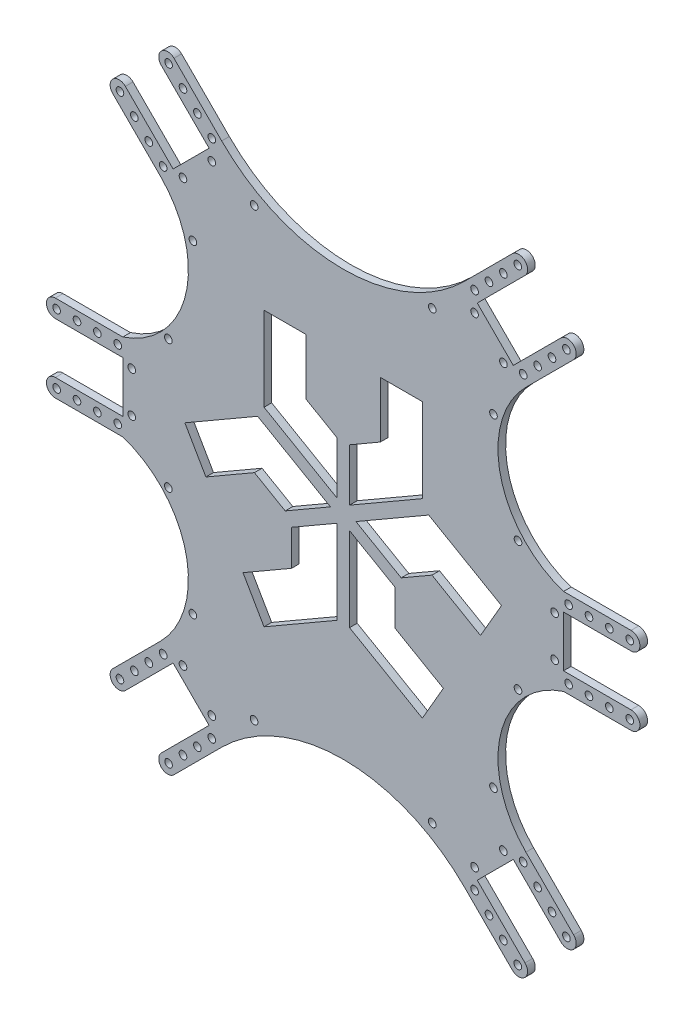
from build123d import *

# Parameters (mm, degrees)
MODEL_R                     = 1.5
DODANIE_WYCI_GNI_CIE1_DEPTH = 3
SZKIC1_R                    = 1.5
WYTNIJ_WYCI_GNI_CIE2_DEPTH  = 2596.666830068


with BuildPart() as part:
    # Model → Dodanie-wyciągnięcie1 (new body)
    with BuildSketch(Plane.XY):
        with BuildLine():
            Line((2252.094823495, 928.366018129), (2233.356493793, 947.104347831))
            ThreePointArc((2233.356493793, 947.104347831), (2228.406746325, 947.104347831), (2228.406746325, 942.154600363))
            Line((2228.406746325, 942.154600363), (2247.145076026, 923.416270661))
            Line((2247.145076026, 923.416270661), (2233.002940402, 909.274135037))
            Line((2233.002940402, 909.274135037), (2214.2646107, 928.012464738))
            ThreePointArc((2214.2646107, 928.012464738), (2209.314863231, 928.012464738), (2209.314863231, 923.062717269))
            Line((2209.314863231, 923.062717269), (2228.053192934, 904.324387567))
            ThreePointArc((2228.053192934, 904.324387567), (2238.000533388, 869.176782474), (2213.278862868, 842.285469146))
            Line((2213.278862868, 842.285469146), (2186.778862868, 842.285469146))
            ThreePointArc((2186.778862868, 842.285469146), (2183.278862869, 838.785469146), (2186.778862868, 835.285469147))
            Line((2186.778862868, 835.285469147), (2213.278857269, 835.285469147))
            Line((2213.278857269, 835.285469147), (2213.278857269, 815.285469147))
            Line((2213.278857269, 815.285469147), (2186.778862868, 815.285469147))
            ThreePointArc((2186.778862868, 815.285469147), (2183.278862867, 811.785469146), (2186.778862868, 808.285469146))
            Line((2186.778862868, 808.285469146), (2213.278862868, 808.285469146))
            ThreePointArc((2213.278862868, 808.285469146), (2238.000533388, 781.394155817), (2228.053192934, 746.246550725))
            Line((2228.053192934, 746.246550725), (2209.314863231, 727.508221022))
            ThreePointArc((2209.314863231, 727.508221022), (2209.314863231, 722.558473553), (2214.2646107, 722.558473553))
            Line((2214.2646107, 722.558473553), (2233.002940402, 741.296803255))
            Line((2233.002940402, 741.296803255), (2247.145076026, 727.15466763))
            Line((2247.145076026, 727.15466763), (2228.406746325, 708.416337929))
            ThreePointArc((2228.406746325, 708.416337929), (2228.406746325, 703.46659046), (2233.356493793, 703.46659046))
            Line((2233.356493793, 703.46659046), (2252.094823495, 722.204920162))
            ThreePointArc((2252.094823495, 722.204920162), (2299.791718302, 741.961620874), (2347.48861311, 722.204920162))
            Line((2347.48861311, 722.204920162), (2366.226942811, 703.46659046))
            ThreePointArc((2366.226942811, 703.46659046), (2371.17669028, 703.46659046), (2371.17669028, 708.416337929))
            Line((2371.17669028, 708.416337929), (2352.438360578, 727.15466763))
            Line((2352.438360578, 727.15466763), (2366.580496203, 741.296803255))
            Line((2366.580496203, 741.296803255), (2385.318825904, 722.558473553))
            ThreePointArc((2385.318825904, 722.558473553), (2390.268573373, 722.558473553), (2390.268573373, 727.508221022))
            Line((2390.268573373, 727.508221022), (2371.530243671, 746.246550725))
            ThreePointArc((2371.530243671, 746.246550725), (2361.582903216, 781.394155817), (2386.304573737, 808.285469146))
            Line((2386.304573737, 808.285469146), (2412.804573737, 808.285469146))
            ThreePointArc((2412.804573737, 808.285469146), (2416.304573737, 811.785469146), (2412.804573737, 815.285469147))
            Line((2412.804573737, 815.285469147), (2386.304579335, 815.285469147))
            Line((2386.304579335, 815.285469147), (2386.304579335, 835.285469147))
            Line((2386.304579335, 835.285469147), (2412.804573737, 835.285469147))
            ThreePointArc((2412.804573737, 835.285469147), (2416.304573736, 838.785469146), (2412.804573737, 842.285469146))
            Line((2412.804573737, 842.285469146), (2386.304573737, 842.285469146))
            ThreePointArc((2386.304573737, 842.285469146), (2361.582903216, 869.176782474), (2371.530243671, 904.324387567))
            Line((2371.530243671, 904.324387567), (2390.268573373, 923.062717269))
            ThreePointArc((2390.268573373, 923.062717269), (2390.268573373, 928.012464738), (2385.318825904, 928.012464738))
            Line((2385.318825904, 928.012464738), (2366.580496203, 909.274135037))
            Line((2366.580496203, 909.274135037), (2352.438360578, 923.416270661))
            Line((2352.438360578, 923.416270661), (2371.17669028, 942.154600363))
            ThreePointArc((2371.17669028, 942.154600363), (2371.17669028, 947.104347831), (2366.226942811, 947.104347831))
            Line((2366.226942811, 947.104347831), (2347.48861311, 928.366018129))
            ThreePointArc((2347.48861311, 928.366018129), (2299.791718302, 908.609317417), (2252.094823495, 928.366018129))
        make_face()
        with Locations((2248.205736198, 927.305357958)):
            Circle(MODEL_R, mode=Mode.SUBTRACT)
        with Locations((2248.205736198, 919.527183364)):
            Circle(MODEL_R, mode=Mode.SUBTRACT)
        with Locations((2229.113853106, 908.213474865)):
            Circle(MODEL_R, mode=Mode.SUBTRACT)
        with Locations((2223.456998856, 913.870329115)):
            Circle(MODEL_R, mode=Mode.SUBTRACT)
        with Locations((2217.800144607, 919.527183364)):
            Circle(MODEL_R, mode=Mode.SUBTRACT)
        with Locations((2212.143290357, 925.184037614)):
            Circle(MODEL_R, mode=Mode.SUBTRACT)
        with Locations((2236.892027699, 908.213474865)):
            Circle(MODEL_R, mode=Mode.SUBTRACT)
        with Locations((2231.235173449, 944.275920706)):
            Circle(MODEL_R, mode=Mode.SUBTRACT)
        with Locations((2236.892027699, 938.619066456)):
            Circle(MODEL_R, mode=Mode.SUBTRACT)
        with Locations((2242.548881948, 932.962212207)):
            Circle(MODEL_R, mode=Mode.SUBTRACT)
        with Locations((2351.377700407, 723.265580334)):
            Circle(MODEL_R, mode=Mode.SUBTRACT)
        with Locations((2382.804579335, 833.285469147)):
            Circle(MODEL_R, mode=Mode.SUBTRACT)
        with Locations((2187.278857269, 838.785469147)):
            Circle(MODEL_R, mode=Mode.SUBTRACT)
        with Locations((2195.278857269, 838.785469147)):
            Circle(MODEL_R, mode=Mode.SUBTRACT)
        with Locations((2203.278857269, 838.785469147)):
            Circle(MODEL_R, mode=Mode.SUBTRACT)
        with Locations((2187.278857269, 811.785469147)):
            Circle(MODEL_R, mode=Mode.SUBTRACT)
        with Locations((2195.278857269, 811.785469147)):
            Circle(MODEL_R, mode=Mode.SUBTRACT)
        with Locations((2203.278857269, 811.785469147)):
            Circle(MODEL_R, mode=Mode.SUBTRACT)
        with Locations((2211.278857269, 811.785469147)):
            Circle(MODEL_R, mode=Mode.SUBTRACT)
        with Locations((2216.778857269, 817.285469147)):
            Circle(MODEL_R, mode=Mode.SUBTRACT)
        with Locations((2211.278857269, 838.785469147)):
            Circle(MODEL_R, mode=Mode.SUBTRACT)
        with Locations((2216.778857269, 833.285469147)):
            Circle(MODEL_R, mode=Mode.SUBTRACT)
        with Locations((2388.304579335, 838.785469147)):
            Circle(MODEL_R, mode=Mode.SUBTRACT)
        with Locations((2351.377700407, 731.043754927)):
            Circle(MODEL_R, mode=Mode.SUBTRACT)
        with Locations((2382.804579335, 817.285469147)):
            Circle(MODEL_R, mode=Mode.SUBTRACT)
        with Locations((2370.469583499, 742.357463426)):
            Circle(MODEL_R, mode=Mode.SUBTRACT)
        with Locations((2376.126437748, 736.700609176)):
            Circle(MODEL_R, mode=Mode.SUBTRACT)
        with Locations((2381.783291998, 731.043754927)):
            Circle(MODEL_R, mode=Mode.SUBTRACT)
        with Locations((2387.440146247, 725.386900677)):
            Circle(MODEL_R, mode=Mode.SUBTRACT)
        with Locations((2362.691408906, 742.357463426)):
            Circle(MODEL_R, mode=Mode.SUBTRACT)
        with Locations((2368.348263155, 706.295017585)):
            Circle(MODEL_R, mode=Mode.SUBTRACT)
        with Locations((2362.691408906, 711.951871835)):
            Circle(MODEL_R, mode=Mode.SUBTRACT)
        with Locations((2357.034554656, 717.608726084)):
            Circle(MODEL_R, mode=Mode.SUBTRACT)
        with Locations((2388.304579335, 811.785469147)):
            Circle(MODEL_R, mode=Mode.SUBTRACT)
        with Locations((2396.304579335, 811.785469147)):
            Circle(MODEL_R, mode=Mode.SUBTRACT)
        with Locations((2404.304579335, 811.785469147)):
            Circle(MODEL_R, mode=Mode.SUBTRACT)
        with Locations((2242.548881948, 717.608726084)):
            Circle(MODEL_R, mode=Mode.SUBTRACT)
        with Locations((2412.304579335, 811.785469147)):
            Circle(MODEL_R, mode=Mode.SUBTRACT)
        with Locations((2396.304579335, 838.785469147)):
            Circle(MODEL_R, mode=Mode.SUBTRACT)
        with Locations((2404.304579335, 838.785469147)):
            Circle(MODEL_R, mode=Mode.SUBTRACT)
        with Locations((2412.304579335, 838.785469147)):
            Circle(MODEL_R, mode=Mode.SUBTRACT)
        with Locations((2236.892027699, 711.951871835)):
            Circle(MODEL_R, mode=Mode.SUBTRACT)
        with Locations((2357.034554656, 932.962212207)):
            Circle(MODEL_R, mode=Mode.SUBTRACT)
        with Locations((2362.691408906, 938.619066456)):
            Circle(MODEL_R, mode=Mode.SUBTRACT)
        with Locations((2368.348263155, 944.275920706)):
            Circle(MODEL_R, mode=Mode.SUBTRACT)
        with Locations((2362.691408906, 908.213474865)):
            Circle(MODEL_R, mode=Mode.SUBTRACT)
        with Locations((2387.440146247, 925.184037614)):
            Circle(MODEL_R, mode=Mode.SUBTRACT)
        with Locations((2381.783291998, 919.527183364)):
            Circle(MODEL_R, mode=Mode.SUBTRACT)
        with Locations((2376.126437748, 913.870329115)):
            Circle(MODEL_R, mode=Mode.SUBTRACT)
        with Locations((2370.469583499, 908.213474865)):
            Circle(MODEL_R, mode=Mode.SUBTRACT)
        with Locations((2351.377700407, 919.527183364)):
            Circle(MODEL_R, mode=Mode.SUBTRACT)
        with Locations((2351.377700407, 927.305357958)):
            Circle(MODEL_R, mode=Mode.SUBTRACT)
        with Locations((2231.235173449, 706.295017585)):
            Circle(MODEL_R, mode=Mode.SUBTRACT)
        with Locations((2236.892027699, 742.357463426)):
            Circle(MODEL_R, mode=Mode.SUBTRACT)
        with Locations((2212.143290357, 725.386900677)):
            Circle(MODEL_R, mode=Mode.SUBTRACT)
        with Locations((2217.800144607, 731.043754927)):
            Circle(MODEL_R, mode=Mode.SUBTRACT)
        with Locations((2223.456998856, 736.700609176)):
            Circle(MODEL_R, mode=Mode.SUBTRACT)
        with Locations((2229.113853106, 742.357463426)):
            Circle(MODEL_R, mode=Mode.SUBTRACT)
        with Locations((2248.205736198, 731.043754927)):
            Circle(MODEL_R, mode=Mode.SUBTRACT)
        with Locations((2248.205736198, 723.265580334)):
            Circle(MODEL_R, mode=Mode.SUBTRACT)
        Polygon((2268.712879977, 879.115596165), (2268.712879977, 846.115596165), (2297.291718302, 829.615596165), (2297.291718302, 850.134657848), (2285.212879977, 857.108378406), (2285.212879977, 879.115596165), align=None, mode=Mode.SUBTRACT)
        Polygon((2361.949394952, 825.285469146), (2333.370556627, 841.785469146), (2304.791718302, 825.285469146), (2322.561746982, 815.025938304), (2334.640585307, 821.999658862), (2353.699394952, 810.996049983), align=None, mode=Mode.SUBTRACT)
        Polygon((2302.291718302, 787.955342127), (2302.291718302, 820.955342127), (2320.061746982, 810.695811285), (2320.061746982, 796.748370168), (2339.120556627, 785.744761289), (2330.870556627, 771.455342127), align=None, mode=Mode.SUBTRACT)
        Polygon((2330.870556627, 846.115596165), (2302.291718302, 829.615596165), (2302.291718302, 850.134657848), (2314.370556627, 857.108378406), (2314.370556627, 879.115596165), (2330.870556627, 879.115596165), align=None, mode=Mode.SUBTRACT)
        Polygon((2279.521689623, 810.695811285), (2297.291718302, 820.955342127), (2297.291718302, 787.955342127), (2268.712879977, 771.455342127), (2260.462879977, 785.744761289), (2279.521689623, 796.748370168), align=None, mode=Mode.SUBTRACT)
        Polygon((2277.021689623, 815.025938304), (2264.942851298, 821.999658862), (2245.884041653, 810.996049983), (2237.634041653, 825.285469146), (2266.212879977, 841.785469146), (2294.791718302, 825.285469146), align=None, mode=Mode.SUBTRACT)
    extrude(amount=DODANIE_WYCI_GNI_CIE1_DEPTH)

    # Szkic1 → Wytnij-wyciągnięcie2 (cut, through all)
    with BuildSketch(Plane(origin=(0, 0, 3), x_dir=(-1, 0, 0), z_dir=(0, 0, -1))):
        with Locations((-2334.760691049, 912.809668943)):
            Circle(SZKIC1_R)
        with Locations((-2358.80232161, 888.768038382)):
            Circle(SZKIC1_R)
        with Locations((-2368.442851257, 850.55952738)):
            Circle(SZKIC1_R)
        with Locations((-2368.442851257, 800.011410911)):
            Circle(SZKIC1_R)
        with Locations((-2358.80232161, 761.802899909)):
            Circle(SZKIC1_R)
        with Locations((-2334.760691049, 737.761269348)):
            Circle(SZKIC1_R)
        with Locations((-2264.822745556, 737.761269348)):
            Circle(SZKIC1_R)
        with Locations((-2240.781114995, 761.802899909)):
            Circle(SZKIC1_R)
        with Locations((-2231.140585347, 800.011410911)):
            Circle(SZKIC1_R)
        with Locations((-2231.140585347, 850.55952738)):
            Circle(SZKIC1_R)
        with Locations((-2240.781114995, 888.768038382)):
            Circle(SZKIC1_R)
        with Locations((-2264.822745556, 912.809668943)):
            Circle(SZKIC1_R)
    extrude(amount=WYTNIJ_WYCI_GNI_CIE2_DEPTH, mode=Mode.SUBTRACT)


solid = part.part
